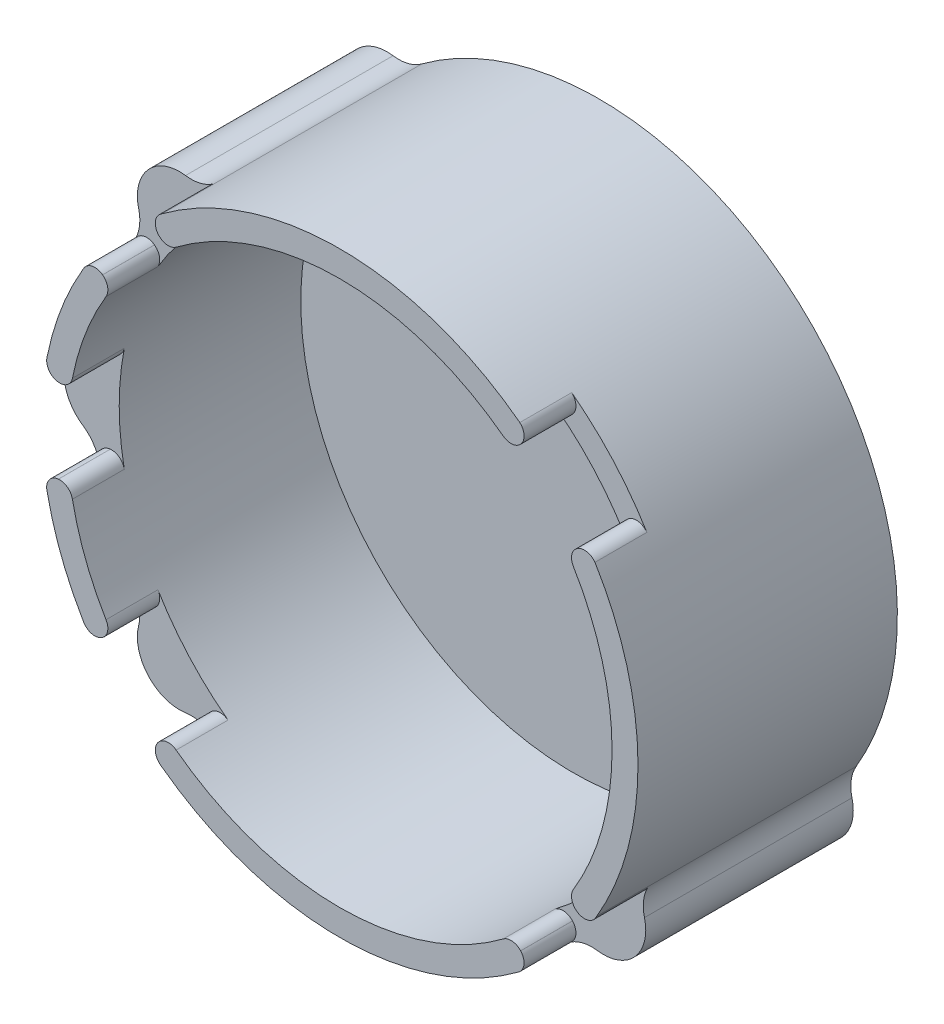
from build123d import *

# Parameters (mm, degrees)
SKETCH_1_R          = 23
EXTRUDE_1_DEPTH     = 20
SKETCH_2_R          = 21
CUT_EXTRUDE_1_DEPTH = 18
EXTRUDE_START       = -20
EXTRUDE_2_DEPTH     = 20
FILLET_1_R          = 3
SKETCH_6_R          = 21
CUT_EXTRUDE_2_DEPTH = 18
CUT_EXTRUDE_START   = -4
SKETCH_7_R          = 3.25
CUT_EXTRUDE_3_DEPTH = 4
FILLET_START        = 16
FILLET_2_DEPTH      = 4
CUT_EXTRUDE_4_REACH = 41.58


with BuildPart() as part:
    # Эскиз1 → Бобышка-Вытянуть1 (new body)
    with BuildSketch(Plane.XY):
        Circle(SKETCH_1_R)
    extrude(amount=EXTRUDE_1_DEPTH)

    # Эскиз2 → Вырез-Вытянуть1 (cut)
    with BuildSketch(Plane.XY.offset(20)):
        Circle(SKETCH_2_R)
    extrude(amount=-CUT_EXTRUDE_1_DEPTH, mode=Mode.SUBTRACT)

    # Эскиз5 → Бобышка-Вытянуть2 (add)
    with BuildSketch(Plane.XY.offset(20).offset(EXTRUDE_START)):
        with BuildLine():
            ThreePointArc((-13.428172595, 16.145717103), (-18.764406843, 16.895547811), (-17.460895421, 11.666924663))
            ThreePointArc((-17.460895421, 11.666924663), (-19.605188956, 7.52572694), (-20.782670455, 3.013404848))
            ThreePointArc((-20.782670455, 3.013404848), (-25.25, 0), (-20.782670455, -3.013404848))
            ThreePointArc((-20.782670455, -3.013404848), (-19.605188956, -7.52572694), (-17.460895421, -11.666924663))
            ThreePointArc((-17.460895421, -11.666924663), (-18.764406843, -16.895547811), (-13.428172595, -16.145717103))
            ThreePointArc((-13.428172595, -16.145717103), (0, -21), (13.428172595, -16.145717103))
            ThreePointArc((13.428172595, -16.145717103), (18.764406843, -16.895547811), (17.460895421, -11.666924663))
            ThreePointArc((17.460895421, -11.666924663), (21, 0), (17.460895421, 11.666924663))
            ThreePointArc((17.460895421, 11.666924663), (18.764406843, 16.895547811), (13.428172595, 16.145717103))
            ThreePointArc((13.428172595, 16.145717103), (0, 21), (-13.428172595, 16.145717103))
        make_face()
    extrude(amount=EXTRUDE_2_DEPTH)

    # Скругление1
    fillet_1_edges = [part.edges().sort_by_distance(p)[0] for p in [
        (19.041496109, 12.900442858, 10),
        (14.820151209, -17.588721334, 10),
        (-19.041496109, -12.900442858, 10),
        (-22.782670455, 3.154350481, 10),
        (-14.820151209, 17.588721334, 10),
        (14.820151209, 17.588721334, 10),
        (19.041496109, -12.900442858, 10),
        (-14.820151209, -17.588721334, 10),
        (-22.782670455, -3.154350481, 10),
        (-19.041496109, 12.900442858, 10),
    ]]
    fillet(fillet_1_edges, radius=FILLET_1_R)

    # Эскиз6 → Вырез-Вытянуть2 (cut)
    with BuildSketch(Plane.XY.offset(20)):
        Circle(SKETCH_6_R)
    extrude(amount=-CUT_EXTRUDE_2_DEPTH, mode=Mode.SUBTRACT)

    # Эскиз7 → Вырез-Вытянуть3 (cut)
    with BuildSketch(Plane.XY.offset(20).offset(CUT_EXTRUDE_START)):
        with Locations((-16.349186161, 14.72087334)):
            Circle(SKETCH_7_R)
        with Locations((16.349186161, 14.72087334)):
            Circle(SKETCH_7_R)
        with Locations((-16.349186161, -14.72087334)):
            Circle(SKETCH_7_R)
        with Locations((-22, 0)):
            Circle(SKETCH_7_R)
        with Locations((16.349186161, -14.72087334)):
            Circle(SKETCH_7_R)
    extrude(amount=CUT_EXTRUDE_3_DEPTH, mode=Mode.SUBTRACT)

    # Скругление2: read off the stored shape, not the designer's step
    # Скругление2 outline → Скругление2 (cut)
    with BuildSketch(Plane.XY.offset(FILLET_START)):
        with BuildLine():
            ThreePointArc((-13.776491508, -18.421379011), (-14.209607213, -17.709819826), (-13.95357615, -16.917132131))
            ThreePointArc((-13.95357615, -16.917132131), (-14.831000199, -17.59447933), (-15.885025704, -17.937557202))
            ThreePointArc((-15.885025704, -17.937557202), (-14.785629767, -17.982793014), (-13.776491508, -18.421379011))
        make_face()
        with BuildLine():
            ThreePointArc((-19.499730713, -13.923020582), (-19.048356591, -12.910630542), (-18.283004183, -12.108815175))
            ThreePointArc((-18.283004183, -12.108815175), (-19.098111986, -12.280585247), (-19.760500256, -11.775464006))
            ThreePointArc((-19.760500256, -11.775464006), (-19.42980055, -12.824918821), (-19.499730713, -13.923020582))
        make_face()
        with BuildLine():
            ThreePointArc((-22.564236885, -4.471480374), (-22.409978551, -3.652877874), (-21.689298793, -3.235114335))
            ThreePointArc((-21.689298793, -3.235114335), (-22.794585678, -3.151370115), (-23.807443182, -2.701045935))
            ThreePointArc((-23.807443182, -2.701045935), (-23.020701446, -3.470302164), (-22.564236885, -4.471480374))
        make_face()
        with BuildLine():
            ThreePointArc((-23.807443182, 2.701045935), (-22.794585678, 3.151370115), (-21.689298793, 3.235114335))
            ThreePointArc((-21.689298793, 3.235114335), (-22.409978551, 3.652877874), (-22.564236885, 4.471480374))
            ThreePointArc((-22.564236885, 4.471480374), (-23.020701446, 3.470302164), (-23.807443182, 2.701045935))
        make_face()
        with BuildLine():
            ThreePointArc((-19.760500256, 11.775464006), (-19.098111986, 12.280585247), (-18.283004183, 12.108815175))
            ThreePointArc((-18.283004183, 12.108815175), (-19.048356591, 12.910630542), (-19.499730713, 13.923020582))
            ThreePointArc((-19.499730713, 13.923020582), (-19.42980055, 12.824918821), (-19.760500256, 11.775464006))
        make_face()
        with BuildLine():
            ThreePointArc((-15.885025704, 17.937557202), (-14.831000199, 17.59447933), (-13.95357615, 16.917132131))
            ThreePointArc((-13.95357615, 16.917132131), (-14.209607213, 17.709819826), (-13.776491508, 18.421379011))
            ThreePointArc((-13.776491508, 18.421379011), (-14.785629767, 17.982793014), (-15.885025704, 17.937557202))
        make_face()
        with BuildLine():
            ThreePointArc((13.776491508, 18.421379011), (14.209607213, 17.709819826), (13.95357615, 16.917132131))
            ThreePointArc((13.95357615, 16.917132131), (14.831000199, 17.59447933), (15.885025704, 17.937557202))
            ThreePointArc((15.885025704, 17.937557202), (14.785629767, 17.982793014), (13.776491508, 18.421379011))
        make_face()
        with BuildLine():
            ThreePointArc((19.499730713, 13.923020582), (19.048356591, 12.910630542), (18.283004183, 12.108815175))
            ThreePointArc((18.283004183, 12.108815175), (19.098111986, 12.280585247), (19.760500256, 11.775464006))
            ThreePointArc((19.760500256, 11.775464006), (19.42980055, 12.824918821), (19.499730713, 13.923020582))
        make_face()
        with BuildLine():
            ThreePointArc((19.760500256, -11.775464006), (19.098111986, -12.280585247), (18.283004183, -12.108815175))
            ThreePointArc((18.283004183, -12.108815175), (19.048356591, -12.910630542), (19.499730713, -13.923020582))
            ThreePointArc((19.499730713, -13.923020582), (19.42980055, -12.824918821), (19.760500256, -11.775464006))
        make_face()
        with BuildLine():
            ThreePointArc((15.885025704, -17.937557202), (14.831000199, -17.59447933), (13.95357615, -16.917132131))
            ThreePointArc((13.95357615, -16.917132131), (14.209607213, -17.709819826), (13.776491508, -18.421379011))
            ThreePointArc((13.776491508, -18.421379011), (14.785629767, -17.982793014), (15.885025704, -17.937557202))
        make_face()
        with BuildLine():
            ThreePointArc((-13.951391744, -16.914747069), (-13.306228642, -16.594083591), (-12.612990263, -16.790249451))
            ThreePointArc((-12.612990263, -16.790249451), (-13.024568946, -16.473026551), (-13.428172595, -16.145717103))
            ThreePointArc((-13.428172595, -16.145717103), (-13.662128037, -16.549046921), (-13.951391744, -16.914747069))
        make_face()
        with BuildLine():
            ThreePointArc((13.428172595, -16.145717103), (13.024568946, -16.473026551), (12.612990263, -16.790249451))
            ThreePointArc((12.612990263, -16.790249451), (13.306228642, -16.594083591), (13.951391744, -16.914747069))
            ThreePointArc((13.951391744, -16.914747069), (13.662128037, -16.549046921), (13.428172595, -16.145717103))
        make_face()
        with BuildLine():
            ThreePointArc((-18.280403854, -12.106892043), (-17.886470759, -11.857439027), (-17.460895421, -11.666924663))
            ThreePointArc((-17.460895421, -11.666924663), (-17.744223765, -11.231318844), (-18.016687197, -10.78883601))
            ThreePointArc((-18.016687197, -10.78883601), (-17.894059096, -11.498781672), (-18.280403854, -12.106892043))
        make_face()
        with BuildLine():
            ThreePointArc((18.016687197, -10.78883601), (17.744223765, -11.231318844), (17.460895421, -11.666924663))
            ThreePointArc((17.460895421, -11.666924663), (17.886470759, -11.857439027), (18.280403854, -12.106892043))
            ThreePointArc((18.280403854, -12.106892043), (17.894059096, -11.498781672), (18.016687197, -10.78883601))
        make_face()
        with BuildLine():
            ThreePointArc((-21.686079545, -3.234803541), (-20.992064177, -3.428202514), (-20.608148244, -4.037849175))
            ThreePointArc((-20.608148244, -4.037849175), (-20.701747261, -3.526706725), (-20.782670455, -3.013404848))
            ThreePointArc((-20.782670455, -3.013404848), (-21.226413556, -3.156590568), (-21.686079545, -3.234803541))
        make_face()
        with BuildLine():
            ThreePointArc((-21.686079545, 3.234803541), (-21.226413556, 3.156590568), (-20.782670455, 3.013404848))
            ThreePointArc((-20.782670455, 3.013404848), (-20.701747261, 3.526706725), (-20.608148244, 4.037849175))
            ThreePointArc((-20.608148244, 4.037849175), (-20.992064177, 3.428202514), (-21.686079545, 3.234803541))
        make_face()
        with BuildLine():
            ThreePointArc((17.460895421, 11.666924663), (17.744223765, 11.231318844), (18.016687197, 10.78883601))
            ThreePointArc((18.016687197, 10.78883601), (17.894059096, 11.498781672), (18.280403854, 12.106892043))
            ThreePointArc((18.280403854, 12.106892043), (17.886470759, 11.857439027), (17.460895421, 11.666924663))
        make_face()
        with BuildLine():
            ThreePointArc((-18.280403854, 12.106892043), (-17.894059096, 11.498781672), (-18.016687197, 10.78883601))
            ThreePointArc((-18.016687197, 10.78883601), (-17.744223765, 11.231318844), (-17.460895421, 11.666924663))
            ThreePointArc((-17.460895421, 11.666924663), (-17.886470759, 11.857439027), (-18.280403854, 12.106892043))
        make_face()
        with BuildLine():
            ThreePointArc((12.612990263, 16.790249451), (13.024568946, 16.473026551), (13.428172595, 16.145717103))
            ThreePointArc((13.428172595, 16.145717103), (13.662128037, 16.549046921), (13.951391744, 16.914747069))
            ThreePointArc((13.951391744, 16.914747069), (13.306228642, 16.594083591), (12.612990263, 16.790249451))
        make_face()
        with BuildLine():
            ThreePointArc((-13.951391744, 16.914747069), (-13.662128037, 16.549046921), (-13.428172595, 16.145717103))
            ThreePointArc((-13.428172595, 16.145717103), (-13.024568946, 16.473026551), (-12.612990263, 16.790249451))
            ThreePointArc((-12.612990263, 16.790249451), (-13.306228642, 16.594083591), (-13.951391744, 16.914747069))
        make_face()
    extrude(amount=FILLET_2_DEPTH, mode=Mode.SUBTRACT)

    # Эскиз8 → Вырез-Вытянуть4 (cut, up to next)
    with BuildSketch(Plane(origin=(0, 0, 0), x_dir=(-1, 0, 0), z_dir=(0, 0, -1)), mode=Mode.PRIVATE) as cut_extrude_4_sk1:
        with BuildLine():
            ThreePointArc((-15.885025704, 17.937557202), (-18.764406843, 16.895547811), (-19.499730713, 13.923020582))
            ThreePointArc((-19.499730713, 13.923020582), (-19.438094361, 12.762156961), (-19.822395798, 11.665017138))
            ThreePointArc((-19.822395798, 11.665017138), (-17.092330986, 15.390003946), (-13.673119525, 18.494480324))
            ThreePointArc((-13.673119525, 18.494480324), (-14.724078663, 17.997601791), (-15.885025704, 17.937557202))
        make_face()
    cut_extrude_4_tool1 = extrude(cut_extrude_4_sk1.sketch, amount=-CUT_EXTRUDE_4_REACH, mode=Mode.PRIVATE) & part.part
    add(cut_extrude_4_tool1.solids().sort_by_distance((17.719386, 15.954607, 0))[0], mode=Mode.SUBTRACT)


solid = part.part
